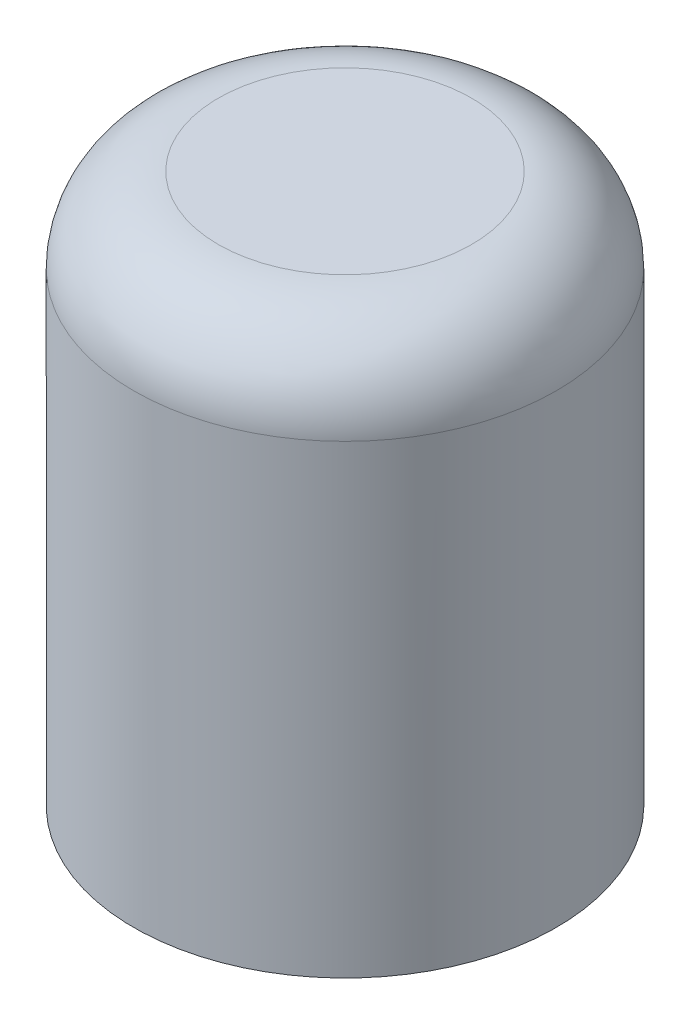
from build123d import *

# Parameters (mm, degrees)
SKETCH1_R           = 5
BOSS_EXTRUDE1_DEPTH = 13
CUT_EXTRUDE1_DEPTH  = 12.5
FILLET4_R           = 2
FILLET5_R           = 0.5
ROUND_BODY_R        = 2


with BuildPart() as part:
    # Sketch1 → Boss-Extrude1 (new body)
    with BuildSketch(Plane(origin=(0, 0, 0), x_dir=(1, 0, 0), z_dir=(0, 1, 0))):
        with Locations(Location((0, 0, 0), (0, 0, 90))):
            Circle(SKETCH1_R)
    extrude(amount=BOSS_EXTRUDE1_DEPTH)

    # Insert → Cut-Extrude1 (cut)
    with BuildSketch(Plane.XZ):
        with BuildLine():
            Line((-1.6, 3), (-1.6, -3))
            ThreePointArc((-1.6, -3), (3.4, 0), (-1.6, 3))
        make_face()
    extrude(amount=-CUT_EXTRUDE1_DEPTH, mode=Mode.SUBTRACT)

    # Fillet4
    # the kernel refuses this fillet: 2 mm, written as the material it adds along each edge
    with BuildSketch(Plane(origin=(0, 12.5, 0), x_dir=(-0.9999950652018581, 0, -0.003141587485880304), z_dir=(-0.003141587485880304, 0, 0.9999950652018581))) as fillet4_piece_1:
        with BuildLine():
            CenterArc((3.4 - FILLET4_R, FILLET4_R), FILLET4_R, 270, 90)
            Line((3.4 - FILLET4_R, 0), (3.4, 0))
            Line((3.4, 0), (3.4, FILLET4_R))
        make_face()
    revolve(axis=Axis((0, 12.5, 0), (0, -1, 0)), revolution_arc=359.64)
    with BuildSketch(Plane(origin=(-1.6, 12.5, 8), x_dir=(0, -1, 0), z_dir=(0, 0, -1))) as fillet4_piece_2_section:
        with BuildLine():
            CenterArc((FILLET4_R, -FILLET4_R), FILLET4_R, 90, 90)
            Line((0, -FILLET4_R), (0, 0))
            Line((0, 0), (FILLET4_R, 0))
        make_face()
    fillet4_piece_2 = extrude(amount=16, mode=Mode.PRIVATE)
    fillet4_piece_2 = fillet4_piece_2 & Plane(origin=(0, 12.061767945, 0), x_dir=(-0.4705882352941176, 0, -0.8823529411764707), z_dir=(0, -1, 0)) * Cylinder(3.4, 40, mode=Mode.PRIVATE)
    add(fillet4_piece_2)

    # Fillet5
    fillet5_edges = [part.edges().sort_by_distance(p)[0] for p in [
        (3.4, 0, 0),
        (-1.6, 0, 0),
    ]]
    fillet(fillet5_edges, radius=FILLET5_R)

    # Round Body
    round_body_edges = [part.edges().sort_by_distance(p)[0] for p in [
        (0, 13, 5),
    ]]
    fillet(round_body_edges, radius=ROUND_BODY_R)


solid = part.part
